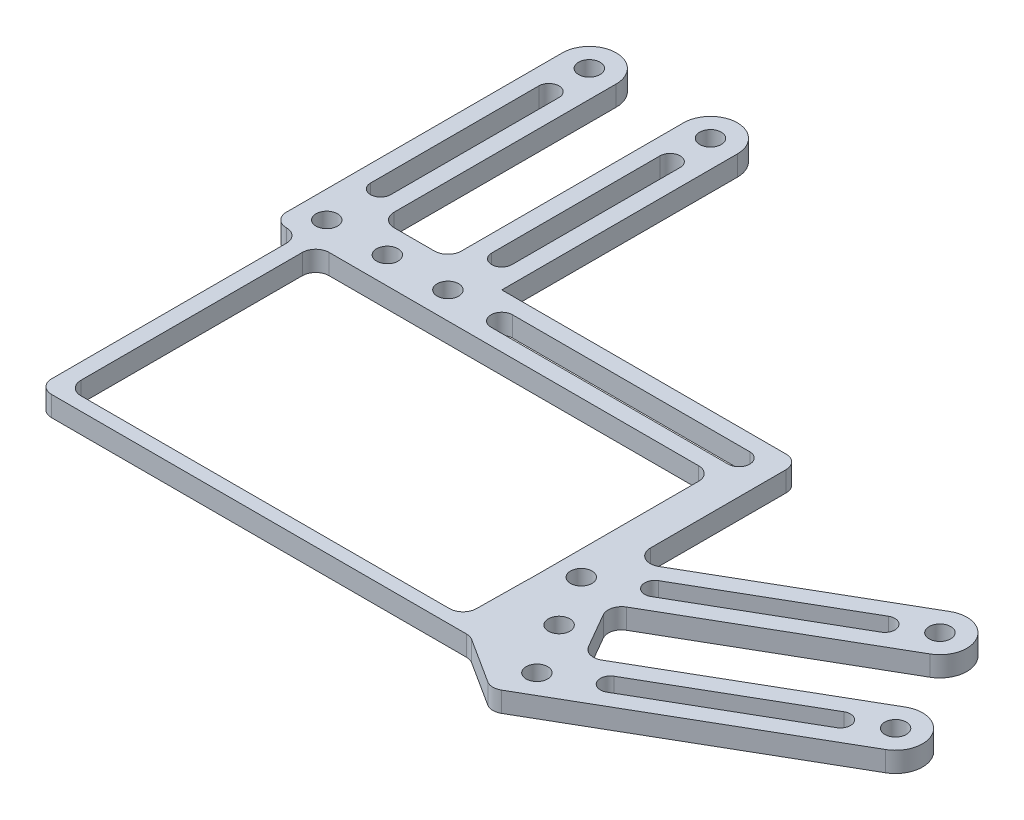
from build123d import *

# Parameters (mm, degrees)
SKETCH1_R           = 1.6
BOSS_EXTRUDE1_DEPTH = 3
FILLET1_R           = 2
FILLET2_R           = 2
CUT_EXTRUDE1_DEPTH  = 3
BOSS_EXTRUDE2_DEPTH = 3
SKETCH5_W           = 5.72828372
SKETCH5_H           = 7.781232697
CUT_EXTRUDE2_DEPTH  = 3
SKETCH6_R           = 1.6
CUT_EXTRUDE3_DEPTH  = 3
FILLET3_R           = 2
CUT_EXTRUDE4_DEPTH  = 3


with BuildPart() as part:
    # Sketch1 → Boss-Extrude1 (new body)
    # profile 1 of 3: a face of its own
    with BuildSketch(Plane(origin=(0, 0, 0), x_dir=(1, 0, 0), z_dir=(0, 1, 0))):
        Polygon((66.235042478, 4), (-4, 4), (-4, -4), (61.235042478, -4), (61.235042478, -28.773130918), (72.398403011, -48.108638544), (79.326606241, -44.108638544), (66.235042478, -21.433384956), align=None)
        with Locations(Location((18, 0, 0), (0, 0, 270))):
            Circle(SKETCH1_R, mode=Mode.SUBTRACT)
        with Locations(Location((9, 0, 0), (0, 0, 270))):
            Circle(SKETCH1_R, mode=Mode.SUBTRACT)
        with Locations(Location((0, 0, 0), (0, 0, 270))):
            Circle(SKETCH1_R, mode=Mode.SUBTRACT)
        with Locations(Location((64.862504626, -27.056079661, 0), (0, 0, 270))):
            Circle(SKETCH1_R, mode=Mode.SUBTRACT)
        with Locations(Location((69.362504626, -34.850308295, 0), (0, 0, 270))):
            Circle(SKETCH1_R, mode=Mode.SUBTRACT)
        with Locations(Location((73.862504626, -42.644536929, 0), (0, 0, 270))):
            Circle(SKETCH1_R, mode=Mode.SUBTRACT)
    # profile 2 of 3: a face of its own
    with BuildSketch(Plane(origin=(0, 0, 0), x_dir=(1, 0, 0), z_dir=(0, 1, 0))):
        Polygon((2.360744243, -4), (0, -4), (0, -42.879937828), (64.221215797, -42.879937828), (61.09340732, -40.879937828), (2.360744243, -40.879937828), align=None)
    # profile 3 of 3: a face of its own
    with BuildSketch(Plane(origin=(0, 0, 0), x_dir=(1, 0, 0), z_dir=(0, 1, 0))):
        Polygon((61.235042478, -28.773130918), (72.398403011, -48.108638544), (61.09340732, -40.879937828), align=None)
    extrude(amount=BOSS_EXTRUDE1_DEPTH)

    # Fillet1
    fillet1_edges = [part.edges().sort_by_distance(p)[0] for p in [
        (61.235042478, 1.5, 28.773130918),
        (61.235042478, 1.5, 4),
        (2.360744243, 1.5, 4),
        (2.360744243, 1.5, 40.879937828),
        (61.09340732, 1.5, 40.879937828),
    ]]
    fillet(fillet1_edges, radius=FILLET1_R)

    # Fillet2
    fillet2_edges = [part.edges().sort_by_distance(p)[0] for p in [
        (0, 1.5, 4),
        (-4, 1.5, 4),
        (-4, 1.5, -4),
        (66.235042478, 1.5, -4),
        (66.235042478, 1.5, 21.433384956),
        (79.326606241, 1.5, 44.108638544),
        (72.398403011, 1.5, 48.108638544),
        (64.221215797, 1.5, 42.879937828),
        (0, 1.5, 42.879937828),
    ]]
    fillet(fillet2_edges, radius=FILLET2_R - 0.0001)  # a hair under: the kernel refuses the full size

    # Sketch2 → Cut-Extrude1 (cut)
    with BuildSketch(Plane(origin=(0, 3, 0), x_dir=(1, 0, 0), z_dir=(0, 1, 0))):
        with BuildLine():
            Line((26, 1.6), (61.235042478, 1.6))
            ThreePointArc((61.235042478, 1.6), (62.835042478, 0), (61.235042478, -1.6))
            Line((61.235042478, -1.6), (26, -1.6))
            ThreePointArc((26, -1.6), (24.4, 0), (26, 1.6))
        make_face()
    extrude(amount=-CUT_EXTRUDE1_DEPTH, mode=Mode.SUBTRACT)

    # Sketch4 → Boss-Extrude2 (add)
    with BuildSketch(Plane(origin=(0, 3, 0), x_dir=(1, 0, 0), z_dir=(0, 1, 0))):
        with BuildLine():
            Line((-2.0001, 4), (4, 4))
            Line((4, 4), (4, 39))
            ThreePointArc((4, 39), (0, 43), (-4, 39))
            Line((-4, 39), (-4, 2.0001))
            ThreePointArc((-4, 2.0001), (-3.414242852, 3.414242852), (-2.0001, 4))
        make_face()
        with BuildLine():
            Line((14, 39), (14, 4))
            Line((14, 4), (22, 4))
            Line((22, 4), (22, 39))
            ThreePointArc((22, 39), (18, 43), (14, 39))
        make_face()
        with BuildLine():
            Line((96.637495374, -4.091978046), (66.35375998, -21.576300827))
            ThreePointArc((66.35375998, -21.576300827), (66.421246357, -21.740191472), (66.502978273, -21.897463366))
            Line((66.502978273, -21.897463366), (70.326606241, -28.520181276))
            Line((70.326606241, -28.520181276), (100.637495374, -11.020181276))
            ThreePointArc((100.637495374, -11.020181276), (102.101596989, -5.556079661), (96.637495374, -4.091978046))
        make_face()
        with BuildLine():
            Line((105.637495374, -19.680435314), (75.326606241, -37.180435314))
            Line((75.326606241, -37.180435314), (78.326656241, -42.376674339))
            ThreePointArc((78.326656241, -42.376674339), (78.526447096, -43.894236547), (77.594642036, -45.108588544))
            Line((77.594642036, -45.108588544), (109.637495374, -26.608638544))
            ThreePointArc((109.637495374, -26.608638544), (111.101596989, -21.144536929), (105.637495374, -19.680435314))
        make_face()
    extrude(amount=-BOSS_EXTRUDE2_DEPTH)

    # Sketch5 → Cut-Extrude2 (cut)
    with BuildSketch(Plane(origin=(0, 3, 0), x_dir=(1, 0, 0), z_dir=(0, 1, 0))):
        with Locations((58.370900618, -27.25388929)):
            Rectangle(SKETCH5_W, SKETCH5_H)
    extrude(amount=-CUT_EXTRUDE2_DEPTH, mode=Mode.SUBTRACT)

    # Sketch6 → Cut-Extrude3 (cut)
    with BuildSketch(Plane(origin=(0, 3, 0), x_dir=(1, 0, 0), z_dir=(0, 1, 0))):
        with Locations(Location((0, 39, 0), (0, 0, 270))):
            Circle(SKETCH6_R)
        with Locations(Location((18, 39, 0), (0, 0, 270))):
            Circle(SKETCH6_R)
        with Locations(Location((98.637495374, -7.556079661, 0), (0, 0, 270))):
            Circle(SKETCH6_R)
        with Locations(Location((107.637495374, -23.144536929, 0), (0, 0, 270))):
            Circle(SKETCH6_R)
    extrude(amount=-CUT_EXTRUDE3_DEPTH, mode=Mode.SUBTRACT)

    # Fillet3
    fillet3_edges = [part.edges().sort_by_distance(p)[0] for p in [
        (14, 1.5, -4),
        (4, 1.5, -4),
        (75.326606241, 1.5, 37.180435314),
        (70.326606241, 1.5, 28.520181276),
        (66.35375998, 1.5, 21.576300827),
    ]]
    fillet(fillet3_edges, radius=FILLET3_R)

    # Sketch8 → Cut-Extrude4 (cut)
    with BuildSketch(Plane(origin=(0, 3, 0), x_dir=(1, 0, 0), z_dir=(0, 1, 0))):
        with BuildLine():
            Line((1.5, 33), (1.5, 8))
            ThreePointArc((1.5, 8), (0, 6.5), (-1.5, 8))
            Line((-1.5, 8), (-1.5, 33))
            ThreePointArc((-1.5, 33), (0, 34.5), (1.5, 33))
        make_face()
        with BuildLine():
            Line((19.5, 33), (19.5, 8))
            ThreePointArc((19.5, 8), (18, 6.5), (16.5, 8))
            Line((16.5, 8), (16.5, 33))
            ThreePointArc((16.5, 33), (18, 34.5), (19.5, 33))
        make_face()
        with BuildLine():
            Line((94.191342951, -11.855117767), (72.540707856, -24.355117767))
            ThreePointArc((72.540707856, -24.355117767), (70.491669751, -23.806079661), (71.040707856, -21.757041555))
            Line((71.040707856, -21.757041555), (92.691342951, -9.257041555))
            ThreePointArc((92.691342951, -9.257041555), (94.740381057, -9.806079661), (94.191342951, -11.855117767))
        make_face()
        with BuildLine():
            Line((103.191342951, -27.443575035), (81.540707856, -39.943575035))
            ThreePointArc((81.540707856, -39.943575035), (79.491669751, -39.394536929), (80.040707856, -37.345498823))
            Line((80.040707856, -37.345498823), (101.691342951, -24.845498823))
            ThreePointArc((101.691342951, -24.845498823), (103.740381057, -25.394536929), (103.191342951, -27.443575035))
        make_face()
    extrude(amount=-CUT_EXTRUDE4_DEPTH, mode=Mode.SUBTRACT)


solid = part.part
